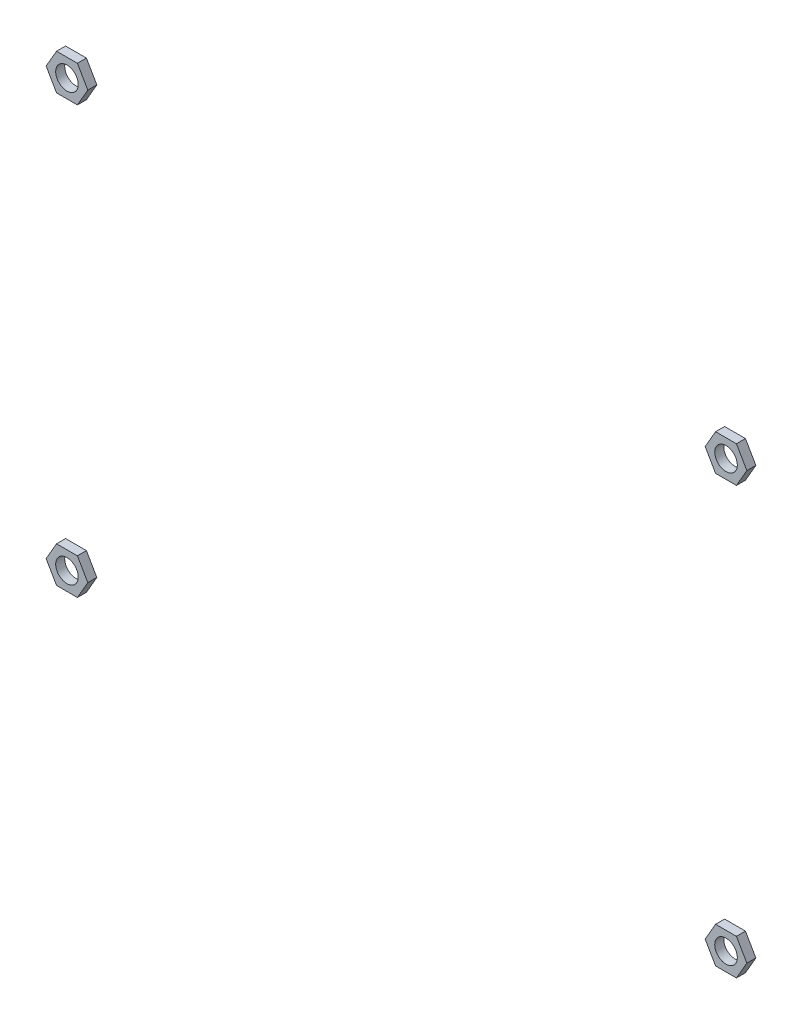
from build123d import *

# Parameters (mm, degrees)
EXTRUDE_1_DEPTH       = 4
SKETCH_3_R            = 5
CUT_EXTRUDE_1_DEPTH   = 57.639025662
MOVE_BODY_2_OUTLINE_R = 5
MOVE_BODY_2_DEPTH     = 4


# Read off the part's stored shape, not the designer's step: 实体-移动/复制2
with BuildPart() as part:
    # 草图2 → 凸台-拉伸1 (new body)
    with BuildSketch(Plane.XY):
        Polygon((-34.579918313, 11.419905632), (-39.198720466, 19.419905632), (-48.436324773, 19.419905632), (-53.055126927, 11.419905632), (-48.436324773, 3.419905632), (-39.198720466, 3.419905632), align=None)
    extrude(amount=EXTRUDE_1_DEPTH)

    # 草图3 → 切除-拉伸1 (cut, through all)
    with BuildSketch(Plane(origin=(0, 0, 0), x_dir=(-1, 0, 0), z_dir=(0, 0, -1))):
        with Locations((43.81752262, 11.419905632)):
            Circle(SKETCH_3_R)
    extrude(amount=-CUT_EXTRUDE_1_DEPTH, mode=Mode.SUBTRACT)


with BuildPart() as body_2:
    # Move Body 1: copy of part
    add(part.part.moved(Location((0, 189, 0))))


with BuildPart() as body_3:
    # Move Body 2 outline → Move Body 2 (new body)
    # profile 1 of 2: a face of its own
    with BuildSketch(Plane.XY):
        Polygon((252.801279534, 3.419905632), (257.420081687, 11.419905632), (252.801279534, 19.419905632), (243.563675227, 19.419905632), (238.944873073, 11.419905632), (243.563675227, 3.419905632), align=None)
        with Locations((248.18247738, 11.419905632)):
            Circle(MOVE_BODY_2_OUTLINE_R, mode=Mode.SUBTRACT)
    # profile 2 of 2: a face of its own
    with BuildSketch(Plane.XY):
        Polygon((252.801279534, 192.419905632), (257.420081687, 200.419905632), (252.801279534, 208.419905632), (243.563675227, 208.419905632), (238.944873073, 200.419905632), (243.563675227, 192.419905632), align=None)
        with Locations((248.18247738, 200.419905632)):
            Circle(MOVE_BODY_2_OUTLINE_R, mode=Mode.SUBTRACT)
    extrude(amount=MOVE_BODY_2_DEPTH)


solid = Compound([part.part, body_2.part, body_3.part])
